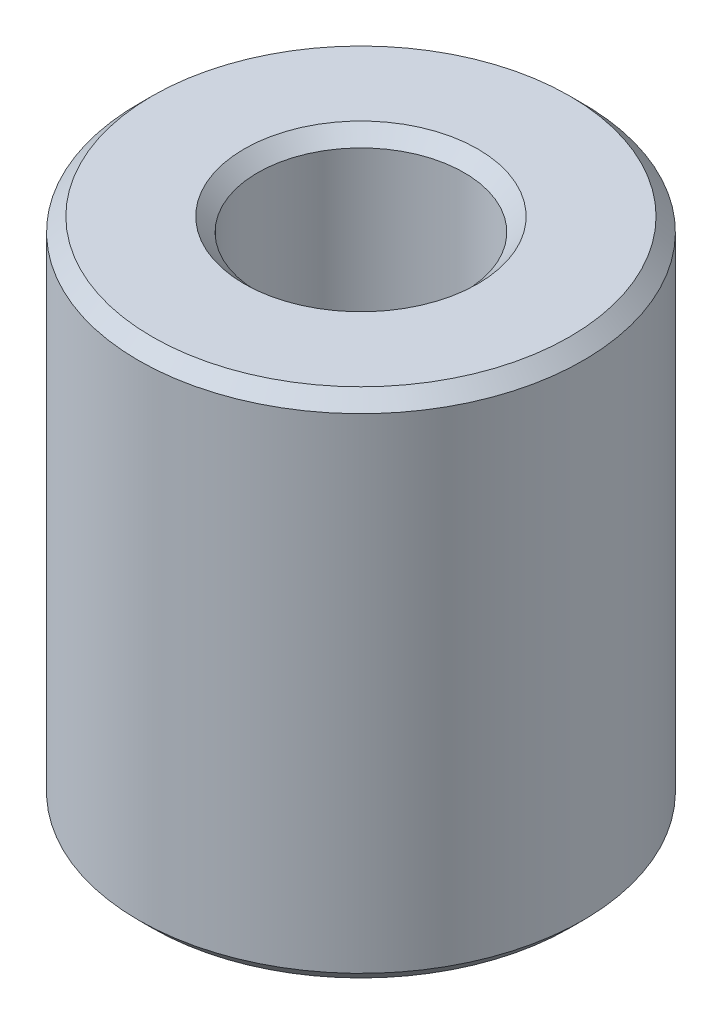
from build123d import *

# Parameters (mm, degrees)
SKETCH1_R           = 10
BOSS_EXTRUDE1_DEPTH = 23.028157459
SKETCH2_R           = 4.640828611
CUT_EXTRUDE1_DEPTH  = 28.023990008
CHAMFER1_SIZE       = 0.614186939


with BuildPart() as part:
    # Sketch1 → Boss-Extrude1 (new body)
    with BuildSketch(Plane(origin=(0, 0, 0), x_dir=(1, 0, 0), z_dir=(0, 1, 0))):
        Circle(SKETCH1_R)
    extrude(amount=BOSS_EXTRUDE1_DEPTH)

    # Sketch2 → Cut-Extrude1 (cut, through all)
    with BuildSketch(Plane(origin=(0, 0, 0), x_dir=(1, 0, 0), z_dir=(0, 1, 0))):
        Circle(SKETCH2_R)
    extrude(amount=CUT_EXTRUDE1_DEPTH, mode=Mode.SUBTRACT)

    # Chamfer1
    chamfer1_edges = [part.edges().sort_by_distance(p)[0] for p in [
        (-4.640828611, 23.028157459, 0),
        (-4.640828611, 0, 0),
        (-10, 0, 0),
        (-10, 23.028157459, 0),
    ]]
    chamfer(chamfer1_edges, length=CHAMFER1_SIZE)


solid = part.part
